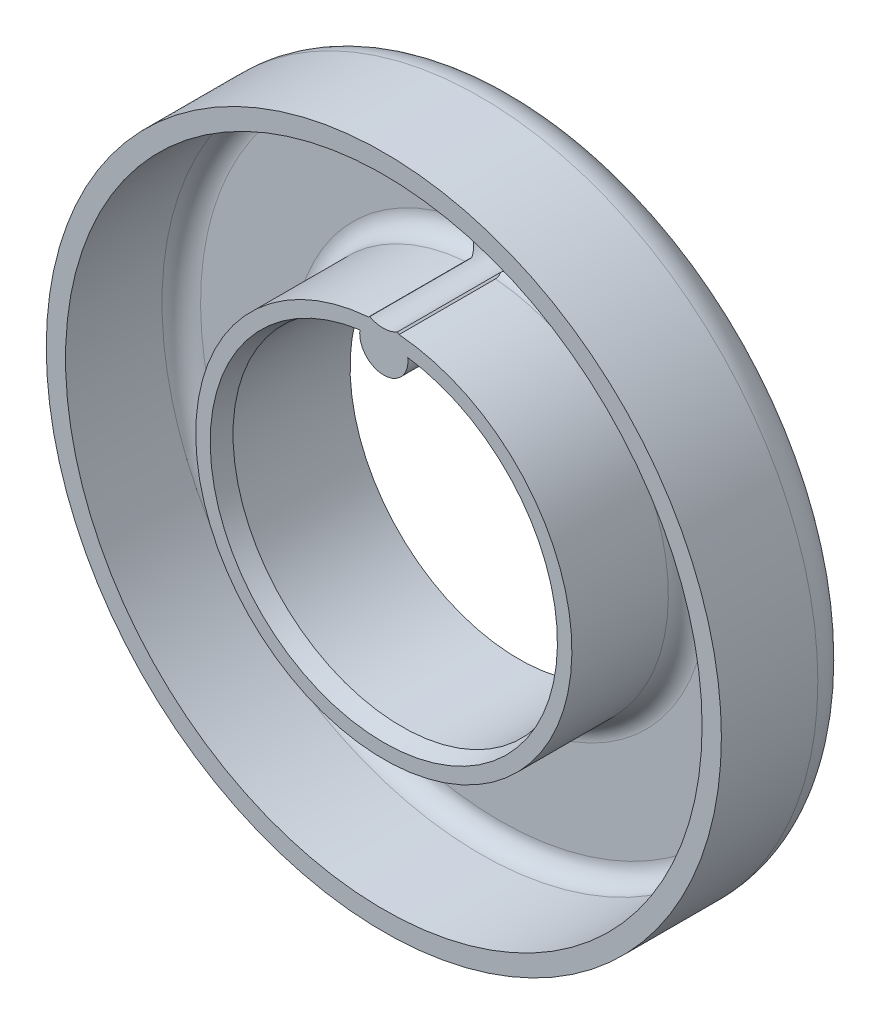
from build123d import *

# Parameters (mm, degrees)
CROQUIS1_R                 = 35
SALIENTE_EXTRUIR1_DEPTH    = 14
CROQUIS2_R                 = 17.5
CORTAR_EXTRUIR1_DEPTH      = 52.439284598
VACIADO1_T                 = -2
CHAFL_N1_SIZE              = 0.5
CHAFL_N1_SIZE2             = 1.866025404
CROQUIS5_R                 = 2.5
SALIENTE_EXTRUIR2_DEPTH    = 14
REDONDEO2_R                = 4
CORTAR_EXTRUIR2_DEPTH      = 51.931326337
CORTAR_EXTRUIR2_DEPTH_BACK = 51.931326337
CORTAR_EXTRUIR3_DEPTH      = 51.931326474
CORTAR_EXTRUIR3_DEPTH_BACK = 51.931326474


with BuildPart() as part:
    # Croquis1 → Saliente-Extruir1 (new body)
    with BuildSketch(Plane.XY):
        Circle(CROQUIS1_R)
    extrude(amount=SALIENTE_EXTRUIR1_DEPTH)

    # Croquis2 → Cortar-Extruir1 (cut, through all)
    with BuildSketch(Plane.XY.offset(14)):
        Circle(CROQUIS2_R)
    extrude(amount=-CORTAR_EXTRUIR1_DEPTH, mode=Mode.SUBTRACT)

    # Vaciado1
    vaciado1_openings = [part.faces().sort_by_distance(p)[0] for p in [
        (-34.010050506, 0, 14),
    ]]
    offset(amount=VACIADO1_T, openings=vaciado1_openings, kind=Kind.INTERSECTION)

    # Chaflán1
    chafl_n1_edges = [part.edges().sort_by_distance(p)[0] for p in [
        (-17.5, 0, 14),
    ]]
    chafl_n1_side = [part.faces().sort_by_distance(p)[0] for p in [
        (-18.948456711, 0, 14),
    ]]
    chamfer(chafl_n1_edges, length=CHAFL_N1_SIZE, length2=CHAFL_N1_SIZE2, reference=chafl_n1_side[0])

    # Croquis5 → Saliente-Extruir2 (add, through all)
    with BuildSketch(Plane(origin=(0, 0, 0), x_dir=(-1, 0, 0), z_dir=(0, 0, -1))):
        with Locations((0, 17.5)):
            Circle(CROQUIS5_R)
    extrude(amount=-SALIENTE_EXTRUIR2_DEPTH)

    # Redondeo1: read off the stored shape, not the designer's step
    # Redondeo1 outline → Redondeo1 (revolve)
    with BuildSketch(Plane.XZ):
        with BuildLine():
            ThreePointArc((21.5, 2), (20.085786438, 2.585786438), (19.5, 4))
            Line((19.5, 4), (19.5, 2))
            Line((19.5, 2), (21.5, 2))
        make_face()
        with BuildLine():
            ThreePointArc((33, 4), (32.414213562, 2.585786438), (31, 2))
            Line((31, 2), (33, 2))
            Line((33, 2), (33, 4))
        make_face()
    revolve(axis=Axis((0, 0, 0), (0, 0, 1)))

    # Redondeo2
    redondeo2_edges = [part.edges().sort_by_distance(p)[0] for p in [
        (-35, 0, 0),
    ]]
    fillet(redondeo2_edges, radius=REDONDEO2_R)

    # Croquis3 → Cortar-Extruir2 (cut, two sides: drawn at the far end of the back side and taken through both)
    with BuildSketch(Plane.XY.offset(2).offset(-CORTAR_EXTRUIR2_DEPTH_BACK)):
        with BuildLine():
            Line((8.410016673, 26.432172655), (2.046055643, 20.068211625))
            ThreePointArc((2.046055643, 20.068211625), (-2.196585045, 20.068211625), (-2.196585045, 24.310852312))
            Line((-2.196585045, 24.310852312), (4.167375986, 30.674813342))
            ThreePointArc((4.167375986, 30.674813342), (8.410016673, 30.674813342), (8.410016673, 26.432172655))
        make_face()
    extrude(amount=CORTAR_EXTRUIR2_DEPTH + CORTAR_EXTRUIR2_DEPTH_BACK, mode=Mode.SUBTRACT)

    # Croquis4 → Cortar-Extruir3 (cut, two sides: drawn at the far end of the back side and taken through both)
    with BuildSketch(Plane.XY.offset(2).offset(-CORTAR_EXTRUIR3_DEPTH_BACK)):
        Polygon((5.089600939, 21.651424089), (4.627973548, 20.226390042), (6.318861503, 19.678641589), (6.081885084, 18.947100367), (7.993733444, 19.923368498), (7.017465313, 21.835216858), (6.780488894, 21.103675636), align=None)
    extrude(amount=CORTAR_EXTRUIR3_DEPTH + CORTAR_EXTRUIR3_DEPTH_BACK, mode=Mode.SUBTRACT)


solid = part.part
